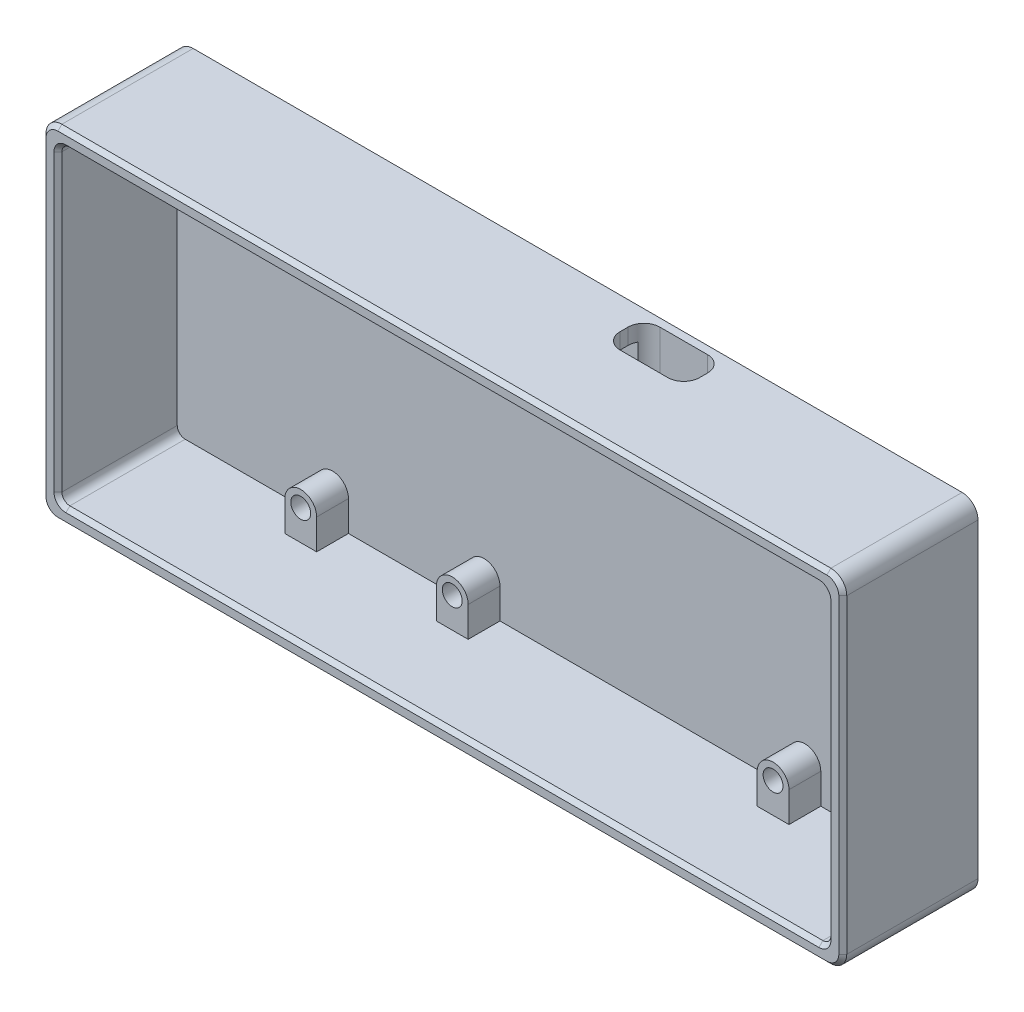
from build123d import *

# Parameters (mm, degrees)
EXTRUDE_1_DEPTH     = 2
SKETCH_2_W          = 10
SKETCH_2_H          = 10
CUT_EXTRUDE_1_DEPTH = 1
EXTRUDE_2_DEPTH     = 15
EXTRUDE_3_DEPTH     = 4
MM_2_D              = 2.5
MM_2_DEPTH          = 4
MM_2_TIP            = 0.751075774
SKETCH_9_W          = 10
SKETCH_9_H          = 5
CUT_EXTRUDE_2_DEPTH = 2
FILLET_1_R          = 2
CHAMFER_1_SIZE      = 0.5


with BuildPart() as part:
    # 草图1 → 凸台-拉伸1 (new body)
    with BuildSketch(Plane.XY):
        with BuildLine():
            Line((2.225416965, 43.522410124), (2.225416965, 4.474270124))
            ThreePointArc((2.225416965, 4.474270124), (2.811203402, 3.060056561), (4.225416965, 2.474270124))
            Line((4.225416965, 2.474270124), (100.900116965, 2.474270124))
            ThreePointArc((100.900116965, 2.474270124), (102.314330527, 3.060056561), (102.900116965, 4.474270124))
            Line((102.900116965, 4.474270124), (102.900116965, 43.522410124))
            ThreePointArc((102.900116965, 43.522410124), (102.314330527, 44.936623686), (100.900116965, 45.522410124))
            Line((100.900116965, 45.522410124), (4.225416965, 45.522410124))
            ThreePointArc((4.225416965, 45.522410124), (2.811203402, 44.936623686), (2.225416965, 43.522410124))
        make_face()
    extrude(amount=EXTRUDE_1_DEPTH)

    # 草图2 → 切除-拉伸1 (cut)
    with BuildSketch(Plane.XY.offset(2)):
        with Locations((66.900116965, 38.523360124)):
            Rectangle(SKETCH_2_W, SKETCH_2_H)
    extrude(amount=-CUT_EXTRUDE_1_DEPTH, mode=Mode.SUBTRACT)

    # 草图3 → 凸台-拉伸2 (add)
    with BuildSketch(Plane.XY.offset(2)):
        with BuildLine():
            Line((100.900116965, 45.522410124), (4.225416965, 45.522410124))
            ThreePointArc((4.225416965, 45.522410124), (2.811203402, 44.936623686), (2.225416965, 43.522410124))
            Line((2.225416965, 43.522410124), (2.225416965, 4.474270124))
            ThreePointArc((2.225416965, 4.474270124), (2.811203402, 3.060056561), (4.225416965, 2.474270124))
            Line((4.225416965, 2.474270124), (100.900116965, 2.474270124))
            ThreePointArc((100.900116965, 2.474270124), (102.314330527, 3.060056561), (102.900116965, 4.474270124))
            Line((102.900116965, 4.474270124), (102.900116965, 43.522410124))
            ThreePointArc((102.900116965, 43.522410124), (102.314330527, 44.936623686), (100.900116965, 45.522410124))
        make_face()
        with BuildLine():
            Line((99.900259554, 43.523360121), (85.135816842, 43.522660124))
            Line((85.135816842, 43.522660124), (81.135817087, 43.522660124))
            Line((81.135817087, 43.522660124), (44.800816842, 43.523360124))
            Line((44.800816842, 43.523360124), (40.800817087, 43.523360124))
            Line((40.800817087, 43.523360124), (25.750866842, 43.523360124))
            Line((25.750866842, 43.523360124), (21.750867087, 43.523360124))
            Line((21.750867087, 43.523360124), (5.225191965, 43.523360124))
            ThreePointArc((5.225191965, 43.523360124), (4.518078599, 43.23046032), (4.225191965, 42.5233415))
            Line((4.225191965, 42.5233415), (4.225881965, 5.474270124))
            ThreePointArc((4.225881965, 5.474270124), (4.518775184, 4.767163343), (5.225881965, 4.474270124))
            Line((5.225881965, 4.474270124), (21.750867087, 4.474270124))
            Line((21.750867087, 4.474270124), (25.750866842, 4.474270124))
            Line((25.750866842, 4.474270124), (40.800817087, 4.474270124))
            Line((40.800817087, 4.474270124), (44.800816842, 4.474270124))
            Line((44.800816842, 4.474270124), (81.135817087, 4.474270124))
            Line((81.135817087, 4.474270124), (85.135816842, 4.474270124))
            Line((85.135816842, 4.474270124), (99.899616965, 4.474270124))
            ThreePointArc((99.899616965, 4.474270124), (100.606717161, 4.767156758), (100.899616964, 5.4742515))
            Line((100.899616964, 5.4742515), (100.900306965, 42.523360124))
            ThreePointArc((100.900306965, 42.523360124), (100.607396983, 43.230483666), (99.900259554, 43.523360121))
        make_face(mode=Mode.SUBTRACT)
    extrude(amount=EXTRUDE_2_DEPTH)

    # 草图4 → 凸台-拉伸3 (add)
    with BuildSketch(Plane.XY.offset(2)):
        with BuildLine():
            Line((21.750867087, 39.723310124), (21.750867087, 43.523360124))
            Line((21.750867087, 43.523360124), (25.750866842, 43.523360124))
            Line((25.750866842, 43.523360124), (25.750866842, 39.722610124))
            ThreePointArc((25.750866842, 39.722610124), (23.750516904, 37.722610216), (21.750867087, 39.723310124))
        make_face()
        with BuildLine():
            Line((40.800817087, 39.722610124), (40.800817087, 43.523360124))
            Line((40.800817087, 43.523360124), (44.800816842, 43.523360124))
            Line((44.800816842, 43.523360124), (44.800816842, 39.721910124))
            ThreePointArc((44.800816842, 39.721910124), (42.800466904, 37.721910216), (40.800817087, 39.722610124))
        make_face()
        with BuildLine():
            Line((81.135817087, 39.722610124), (81.135817087, 43.522660124))
            Line((81.135817087, 43.522660124), (85.135816842, 43.522660124))
            Line((85.135816842, 43.522660124), (85.135816842, 39.721910124))
            ThreePointArc((85.135816842, 39.721910124), (83.135466904, 37.721910216), (81.135817087, 39.722610124))
        make_face()
        with BuildLine():
            Line((21.750867087, 8.273350124), (21.750867087, 4.474270124))
            Line((21.750867087, 4.474270124), (25.750866842, 4.474270124))
            Line((25.750866842, 4.474270124), (25.750866842, 8.272650124))
            ThreePointArc((25.750866842, 8.272650124), (23.751217026, 10.273350032), (21.750867087, 8.273350124))
        make_face()
        with BuildLine():
            Line((40.800817087, 8.272650124), (40.800817087, 4.474270124))
            Line((40.800817087, 4.474270124), (44.800816842, 4.474270124))
            Line((44.800816842, 4.474270124), (44.800816842, 8.271950124))
            ThreePointArc((44.800816842, 8.271950124), (42.801167026, 10.272650032), (40.800817087, 8.272650124))
        make_face()
        with BuildLine():
            Line((81.135817087, 8.273350124), (81.135817087, 4.474270124))
            Line((81.135817087, 4.474270124), (85.135816842, 4.474270124))
            Line((85.135816842, 4.474270124), (85.135816842, 8.272650124))
            ThreePointArc((85.135816842, 8.272650124), (83.136167026, 10.273350032), (81.135817087, 8.273350124))
        make_face()
    extrude(amount=EXTRUDE_3_DEPTH)

    # 大小mm 暗销孔2
    with Locations(Plane(origin=(23.750866904, 39.722610124, 6), x_dir=(1, 0, 0), z_dir=(0, 0, 1))):
        with Locations((0, 0), (19.04995, -0.0007), (59.38495, -0.0007), (59.384950122, -31.44926), (19.049950122, -31.44996), (1.22e-07, -31.44926)):
            Hole(MM_2_D / 2, depth=MM_2_DEPTH)
            with Locations((0, 0, -(MM_2_DEPTH + MM_2_TIP / 2))):  # 118° drill point
                Cone(0, MM_2_D / 2, MM_2_TIP, mode=Mode.SUBTRACT)

    # 草图9 → 切除-拉伸2 (cut)
    with BuildSketch(Plane(origin=(0, 45.522410124, 0), x_dir=(1, 0, 0), z_dir=(0, 1, 0))):
        with Locations((66.900116965, -3.5)):
            Rectangle(SKETCH_9_W, SKETCH_9_H)
    extrude(amount=-CUT_EXTRUDE_2_DEPTH, mode=Mode.SUBTRACT)

    # 圆角1
    # the kernel refuses this fillet: 2 mm, written as the material it adds along each edge
    with BuildSketch(Plane(origin=(61.900116965, 45.522410124, 6), x_dir=(0, 0, -1), z_dir=(0, -1, 0))) as fillet_1_piece_1_section:
        with BuildLine():
            CenterArc((FILLET_1_R, FILLET_1_R), FILLET_1_R, 180, 90)
            Line((0, FILLET_1_R), (0, 0))
            Line((0, 0), (FILLET_1_R, 0))
        make_face()
    fillet_1_piece_1 = extrude(amount=6.999379421, mode=Mode.PRIVATE)
    fillet_1_piece_1 = split(fillet_1_piece_1, bisect_by=Plane(origin=(62.352889725, 43.52302198, 5.54721083), z_dir=(1.9265171188797207e-05, 0.9999999998144267, 0)), keep=Keep.TOP, mode=Mode.PRIVATE)
    add(fillet_1_piece_1)
    with BuildSketch(Plane(origin=(71.900116965, 45.522410124, 6), x_dir=(-1, 0, 0), z_dir=(0, -1, 0))) as fillet_1_piece_2_section:
        with BuildLine():
            CenterArc((FILLET_1_R, FILLET_1_R), FILLET_1_R, 180, 90)
            Line((0, FILLET_1_R), (0, 0))
            Line((0, 0), (FILLET_1_R, 0))
        make_face()
    fillet_1_piece_2 = extrude(amount=6.999572073, mode=Mode.PRIVATE)
    fillet_1_piece_2 = split(fillet_1_piece_2, bisect_by=Plane(origin=(71.447309266, 43.522846774, 5.547208713), z_dir=(1.9265171188797207e-05, 0.9999999998144267, 0)), keep=Keep.TOP, mode=Mode.PRIVATE)
    add(fillet_1_piece_2)
    with BuildSketch(Plane(origin=(71.900116965, 28.523360124, 1), x_dir=(0, 0, 1), z_dir=(0, 1, 0))) as fillet_1_piece_3_section:
        with BuildLine():
            CenterArc((FILLET_1_R, -FILLET_1_R), FILLET_1_R, 90, 90)
            Line((0, -FILLET_1_R), (0, 0))
            Line((0, 0), (FILLET_1_R, 0))
        make_face()
    fillet_1_piece_3 = extrude(amount=16.99905, mode=Mode.PRIVATE)
    fillet_1_piece_3 = split(fillet_1_piece_3, bisect_by=Plane(origin=(71.389876845, 33.523360124, 1.328783529), z_dir=(0, -1, 0)), keep=Keep.TOP, mode=Mode.PRIVATE)
    fillet_1_piece_3 = split(fillet_1_piece_3, bisect_by=Plane(origin=(71.389876845, 31.023360124, 2), z_dir=(0, 0, -1)), keep=Keep.TOP, mode=Mode.PRIVATE)
    add(fillet_1_piece_3)
    with BuildSketch(Plane(origin=(71.900116965, 33.523360124, 1), x_dir=(0, 0, 1), z_dir=(0, 1, 0))) as fillet_1_piece_4_section:
        with BuildLine():
            CenterArc((FILLET_1_R, -FILLET_1_R), FILLET_1_R, 90, 90)
            Line((0, -FILLET_1_R), (0, 0))
            Line((0, 0), (FILLET_1_R, 0))
        make_face()
    fillet_1_piece_4 = extrude(amount=11.99905, mode=Mode.PRIVATE)
    fillet_1_piece_4 = split(fillet_1_piece_4, bisect_by=Plane(origin=(71.389876488, 38.523104002, 2), z_dir=(0, 0, -1)), keep=Keep.TOP, mode=Mode.PRIVATE)
    fillet_1_piece_4 = split(fillet_1_piece_4, bisect_by=Plane(origin=(71.389972809, 43.522847879, 1.3287834), z_dir=(-1.9265171188797207e-05, -0.9999999998144267, 0)), keep=Keep.TOP, mode=Mode.PRIVATE)
    add(fillet_1_piece_4)
    with BuildSketch(Plane(origin=(71.900116965, 33.523360124, 1), x_dir=(0, 0, 1), z_dir=(0, 1, 0))) as fillet_1_piece_5_section:
        with BuildLine():
            CenterArc((FILLET_1_R, -FILLET_1_R), FILLET_1_R, 90, 90)
            Line((0, -FILLET_1_R), (0, 0))
            Line((0, 0), (FILLET_1_R, 0))
        make_face()
    fillet_1_piece_5 = extrude(amount=11.99905, mode=Mode.PRIVATE)
    fillet_1_piece_5 = split(fillet_1_piece_5, bisect_by=Plane(origin=(71.852100247, 44.52262455, 2), z_dir=(0, 0, 1)), keep=Keep.TOP, mode=Mode.PRIVATE)
    fillet_1_piece_5 = split(fillet_1_piece_5, bisect_by=Plane(origin=(71.852080986, 43.522838976, 2.326501665), z_dir=(1.9265171188797207e-05, 0.9999999998144267, 0)), keep=Keep.TOP, mode=Mode.PRIVATE)
    add(fillet_1_piece_5)
    with BuildSketch(Plane(origin=(71.900116965, 33.523360124, 1), x_dir=(0, 0, 1), z_dir=(0, 1, 0))) as fillet_1_piece_6_section:
        with BuildLine():
            CenterArc((FILLET_1_R, -FILLET_1_R), FILLET_1_R, 90, 90)
            Line((0, -FILLET_1_R), (0, 0))
            Line((0, 0), (FILLET_1_R, 0))
        make_face()
    fillet_1_piece_6 = extrude(amount=11.99905, mode=Mode.PRIVATE)
    fillet_1_piece_6 = split(fillet_1_piece_6, bisect_by=Plane(origin=(71.389878628, 44.522629002, 2), z_dir=(0, 0, -1)), keep=Keep.TOP, mode=Mode.PRIVATE)
    fillet_1_piece_6 = split(fillet_1_piece_6, bisect_by=Plane(origin=(71.389859367, 43.522847881, 1.328784171), z_dir=(1.9265171188797207e-05, 0.9999999998144267, 0)), keep=Keep.TOP, mode=Mode.PRIVATE)
    add(fillet_1_piece_6)
    with BuildSketch(Plane(origin=(61.900116965, 45.522410124, 1), x_dir=(0, 0, 1), z_dir=(0, -1, 0))) as fillet_1_piece_7_section:
        with BuildLine():
            CenterArc((FILLET_1_R, -FILLET_1_R), FILLET_1_R, 90, 90)
            Line((0, -FILLET_1_R), (0, 0))
            Line((0, 0), (FILLET_1_R, 0))
        make_face()
    fillet_1_piece_7 = extrude(amount=11.99905, mode=Mode.PRIVATE)
    fillet_1_piece_7 = split(fillet_1_piece_7, bisect_by=Plane(origin=(61.948114515, 43.523029778, 2.326501473), z_dir=(1.9265171188797207e-05, 0.9999999998144267, 0)), keep=Keep.TOP, mode=Mode.PRIVATE)
    fillet_1_piece_7 = split(fillet_1_piece_7, bisect_by=Plane(origin=(61.948133774, 44.522719951, 2), z_dir=(0, 0, 1)), keep=Keep.TOP, mode=Mode.PRIVATE)
    add(fillet_1_piece_7)
    with BuildSketch(Plane(origin=(61.900116965, 45.522410124, 1), x_dir=(0, 0, 1), z_dir=(0, -1, 0))) as fillet_1_piece_8_section:
        with BuildLine():
            CenterArc((FILLET_1_R, -FILLET_1_R), FILLET_1_R, 90, 90)
            Line((0, -FILLET_1_R), (0, 0))
            Line((0, 0), (FILLET_1_R, 0))
        make_face()
    fillet_1_piece_8 = extrude(amount=11.99905, mode=Mode.PRIVATE)
    fillet_1_piece_8 = split(fillet_1_piece_8, bisect_by=Plane(origin=(62.410339609, 43.523020873, 1.328782886), z_dir=(1.9265171188797207e-05, 0.9999999998144267, 0)), keep=Keep.TOP, mode=Mode.PRIVATE)
    fillet_1_piece_8 = split(fillet_1_piece_8, bisect_by=Plane(origin=(62.410358868, 44.522715498, 2), z_dir=(0, 0, -1)), keep=Keep.TOP, mode=Mode.PRIVATE)
    add(fillet_1_piece_8)
    with BuildSketch(Plane(origin=(61.900116965, 45.522410124, 1), x_dir=(0, 0, 1), z_dir=(0, -1, 0))) as fillet_1_piece_9_section:
        with BuildLine():
            CenterArc((FILLET_1_R, -FILLET_1_R), FILLET_1_R, 90, 90)
            Line((0, -FILLET_1_R), (0, 0))
            Line((0, 0), (FILLET_1_R, 0))
        make_face()
    fillet_1_piece_9 = extrude(amount=11.99905, mode=Mode.PRIVATE)
    fillet_1_piece_9 = split(fillet_1_piece_9, bisect_by=Plane(origin=(62.410453051, 43.523020871, 1.328783657), z_dir=(-1.9265171188797207e-05, -0.9999999998144267, 0)), keep=Keep.TOP, mode=Mode.PRIVATE)
    fillet_1_piece_9 = split(fillet_1_piece_9, bisect_by=Plane(origin=(62.410356728, 38.523190498, 2), z_dir=(0, 0, -1)), keep=Keep.TOP, mode=Mode.PRIVATE)
    add(fillet_1_piece_9)
    with BuildSketch(Plane(origin=(61.900116965, 45.522410124, 1), x_dir=(0, 0, 1), z_dir=(0, -1, 0))) as fillet_1_piece_10_section:
        with BuildLine():
            CenterArc((FILLET_1_R, -FILLET_1_R), FILLET_1_R, 90, 90)
            Line((0, -FILLET_1_R), (0, 0))
            Line((0, 0), (FILLET_1_R, 0))
        make_face()
    fillet_1_piece_10 = extrude(amount=16.99905, mode=Mode.PRIVATE)
    fillet_1_piece_10 = split(fillet_1_piece_10, bisect_by=Plane(origin=(62.410357085, 31.023360124, 2), z_dir=(0, 0, -1)), keep=Keep.TOP, mode=Mode.PRIVATE)
    fillet_1_piece_10 = split(fillet_1_piece_10, bisect_by=Plane(origin=(62.410357085, 33.523360124, 1.328783529), z_dir=(0, -1, 0)), keep=Keep.TOP, mode=Mode.PRIVATE)
    add(fillet_1_piece_10)

    # 倒角1
    chamfer_1_edges = [part.edges().sort_by_distance(p)[0] for p in [
        (102.314330527, 44.936623686, 17),
        (52.562766965, 45.522410124, 17),
        (2.811203402, 44.936623686, 17),
        (2.225416965, 23.998340124, 17),
        (2.811203402, 3.060056561, 17),
        (52.562766965, 2.474270124, 17),
        (102.314330527, 3.060056561, 17),
        (102.900116965, 23.998340124, 17),
        (100.607396983, 43.230483666, 17),
        (92.518038198, 43.523010123, 17),
        (83.135816965, 43.522660124, 17),
        (62.968316965, 43.523010124, 17),
        (25.013004404, 43.523360124, 17),
        (4.518078599, 43.23046032, 17),
        (4.225536965, 23.998805812, 17),
        (4.518775184, 4.767163343, 17),
        (52.562749465, 4.474270124, 17),
        (100.606717161, 4.767156758, 17),
        (100.899961965, 23.998805812, 17),
    ]]
    chamfer(chamfer_1_edges, length=CHAMFER_1_SIZE)


solid = part.part
